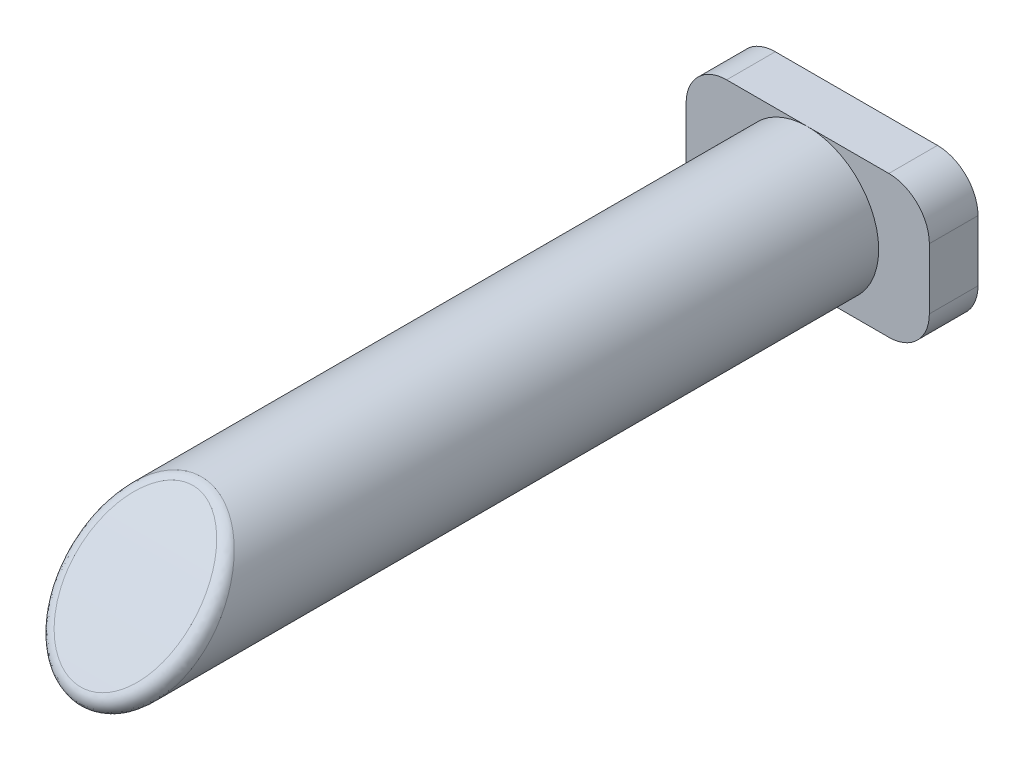
from build123d import *

# Parameters (mm, degrees)
ESQUISSE1_W             = 6
ESQUISSE1_H             = 3.5
BOSS_EXTRU_1_DEPTH      = 1.2
ESQUISSE2_R             = 1.75
BOSS_EXTRU_2_DEPTH      = 18.5
ENL_V_MAT_EXTRU_1_DEPTH = 10
CONG_1_R                = 0.3
CONG_2_R                = 1


with BuildPart() as part:
    # Esquisse1 → Boss.-Extru.1 (new body)
    with BuildSketch(Plane.XY):
        with Locations((-3, 1.75)):
            Rectangle(ESQUISSE1_W, ESQUISSE1_H)
    extrude(amount=BOSS_EXTRU_1_DEPTH)

    # Esquisse2 → Boss.-Extru.2 (add)
    with BuildSketch(Plane.XY.offset(1.2)):
        with Locations((-3, 1.75)):
            Circle(ESQUISSE2_R)
    extrude(amount=BOSS_EXTRU_2_DEPTH)

    # Esquisse4 → Enlèv. mat.-Extru.1 (cut)
    with BuildSketch(Plane(origin=(0, 0, 0), x_dir=(0, 0, -1), z_dir=(1, 0, 0))):
        with BuildLine():
            Line((4.031511661, 14.132113513), (2.361728568, 22.193087234))
            ThreePointArc((2.361728568, 22.193087234), (-15.243551736, 14.825301234), (-28.803921054, 1.395984459))
            Line((-28.803921054, 1.395984459), (-29.244630581, -26.080434717))
            ThreePointArc((-29.244630581, -26.080434717), (-19.66522325, -0.133070926), (4.031511661, 14.132113513))
        make_face()
    extrude(amount=-ENL_V_MAT_EXTRU_1_DEPTH, mode=Mode.SUBTRACT)

    # Congé1
    cong_1_edges = [part.edges().sort_by_distance(p)[0] for p in [
        (-4.748587955, 1.820285512, 17.943411201),
    ]]
    fillet(cong_1_edges, radius=CONG_1_R)

    # Congé2
    cong_2_edges = [part.edges().sort_by_distance(p)[0] for p in [
        (-6, 3.5, 0.6),
        (0, 3.5, 0.6),
        (-6, 0, 0.6),
        (0, 0, 0.6),
    ]]
    fillet(cong_2_edges, radius=CONG_2_R)


solid = part.part
